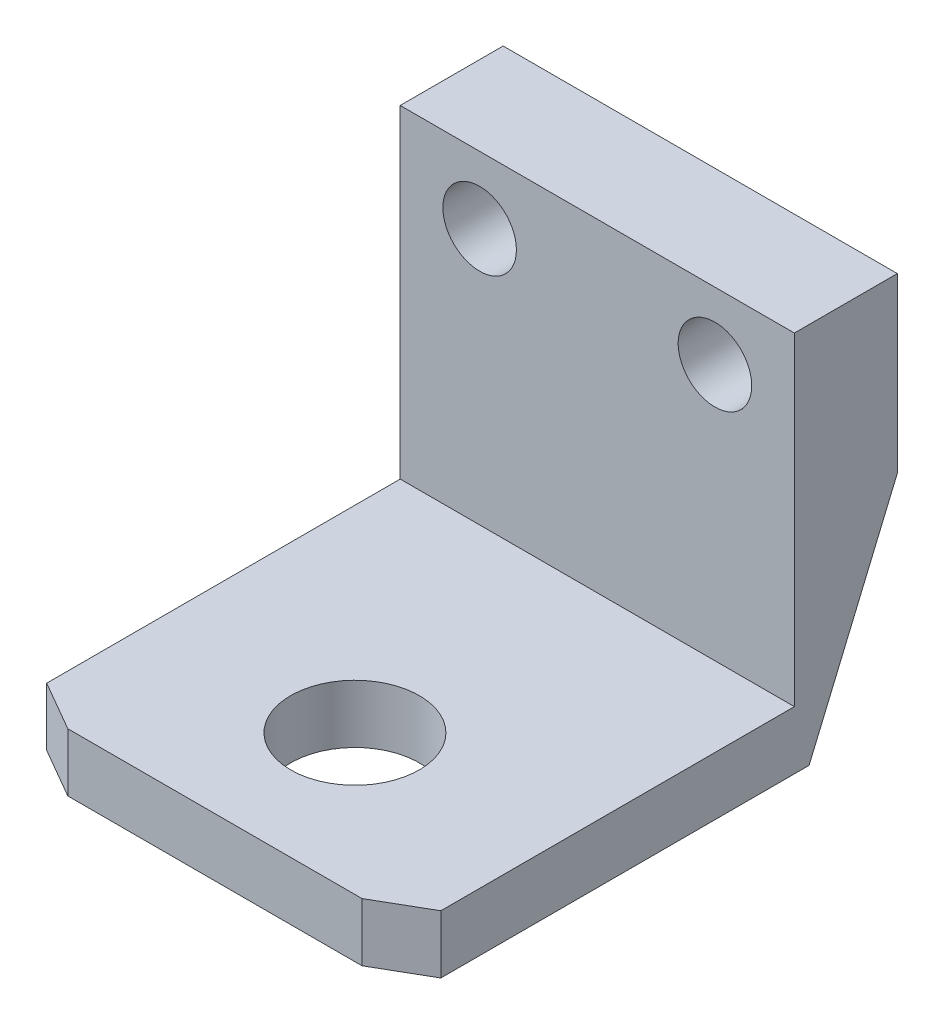
from build123d import *

# Parameters (mm, degrees)
BOSS_EXTRUDE1_DEPTH         = 5.0292
SKETCH2_W                   = 34.036
SKETCH2_H                   = 8.89
BOSS_EXTRUDE2_DEPTH         = 32.9692
CUT_EXTRUDE1_DEPTH          = 61.762903104
CUT_EXTRUDE1_DEPTH_BACK     = 61.762903104
F_1_4_0_25_DIAMETER_HOLE1_D = 6.35
SKETCH7_R                   = 5.55625
CUT_EXTRUDE2_DEPTH          = 47.642102064
F_4_40_TAPPED_HOLE1_D       = 2.2606
SKETCH11_W                  = 10.033
SKETCH11_H                  = 24.033553713
CUT_EXTRUDE3_DEPTH          = 47.642102064


with BuildPart() as part:
    # Sketch1 → Boss-Extrude1 (new body)
    with BuildSketch(Plane(origin=(0, 0, 0), x_dir=(1, 0, 0), z_dir=(0, 1, 0))):
        Polygon((-27.051, 7.874), (-17.018, 7.874), (-17.018, 16.860446287), (17.018, 16.860446287), (17.018, 7.874), (27.051, 7.874), (27.051, -7.874), (12.7, -16.159553713), (-12.7, -16.159553713), (-27.051, -7.874), align=None)
    extrude(amount=BOSS_EXTRUDE1_DEPTH)

    # Sketch2 → Boss-Extrude2 (add)
    with BuildSketch(Plane(origin=(0, 0, 0), x_dir=(1, 0, 0), z_dir=(0, 1, 0))):
        with Locations((0, 21.305446287)):
            Rectangle(SKETCH2_W, SKETCH2_H)
    extrude(amount=BOSS_EXTRUDE2_DEPTH)

    # Sketch3 → Cut-Extrude1 (cut, two sides: drawn at the far end of the back side and taken through both)
    with BuildSketch(Plane(origin=(17.018, 0, 0), x_dir=(0, 0, -1), z_dir=(1, 0, 0)).offset(-CUT_EXTRUDE1_DEPTH_BACK)):
        Polygon((66.671605927, 114.880744481), (25.750446287, 18.034), (18.130446287, 0), (-22.790713353, -96.846744481), (170.902775608, -178.68906376), (260.365094888, 33.038425201), align=None)
    extrude(amount=CUT_EXTRUDE1_DEPTH + CUT_EXTRUDE1_DEPTH_BACK, mode=Mode.SUBTRACT)

    # 1/4 (0.25) Diameter Hole1 (through all)
    with Locations(Plane.XY.offset(-16.860446287)):
        with Locations((-10.16, 27.178), (10.16, 27.178)):
            Hole(F_1_4_0_25_DIAMETER_HOLE1_D / 2)

    # Sketch7 → Cut-Extrude2 (cut, through all)
    with BuildSketch(Plane(origin=(0, 5.0292, 0), x_dir=(1, 0, 0), z_dir=(0, 1, 0))):
        with Locations((0, -4.064)):
            Circle(SKETCH7_R)
    extrude(amount=-CUT_EXTRUDE2_DEPTH, mode=Mode.SUBTRACT)

    # #4-40 Tapped Hole1 (through all)
    with Locations(Plane(origin=(0, 5.0292, 0), x_dir=(1, 0, 0), z_dir=(0, 1, 0))):
        with Locations((23.241, -4.064), (-23.241, -4.064)):
            Hole(F_4_40_TAPPED_HOLE1_D / 2)

    # Sketch11 → Cut-Extrude3 (cut, through all)
    with BuildSketch(Plane(origin=(0, 5.0292, 0), x_dir=(1, 0, 0), z_dir=(0, 1, 0))):
        with Locations((-22.0345, -4.142776857)):
            Rectangle(SKETCH11_W, SKETCH11_H)
        with Locations((22.0345, -4.142776857)):
            Rectangle(SKETCH11_W, SKETCH11_H)
    extrude(amount=-CUT_EXTRUDE3_DEPTH, mode=Mode.SUBTRACT)


solid = part.part
